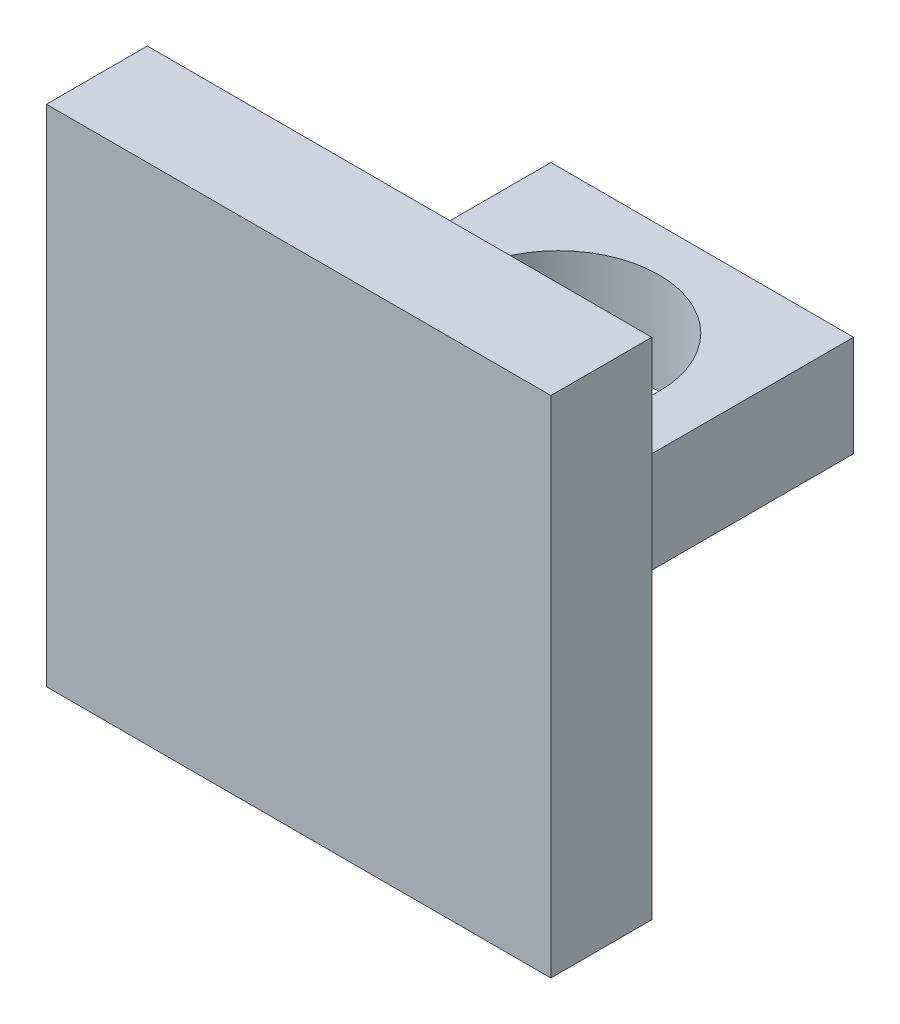
from build123d import *

# Parameters (mm, degrees)
SKETCH_1_W          = 50
SKETCH_1_H          = 50
EXTRUDE_1_DEPTH     = 10
SKETCH_2_W          = 30
SKETCH_2_H          = 10
EXTRUDE_2_DEPTH     = 30
SKETCH_3_R          = 10
CUT_EXTRUDE_1_DEPTH = 30


with BuildPart() as part:
    # 草图1 → 凸台-拉伸1 (new body)
    with BuildSketch(Plane.XY):
        Rectangle(SKETCH_1_W, SKETCH_1_H)
    extrude(amount=EXTRUDE_1_DEPTH)

    # 草图2 → 凸台-拉伸2 (add)
    with BuildSketch(Plane(origin=(0, 0, 0), x_dir=(-1, 0, 0), z_dir=(0, 0, -1))):
        Rectangle(SKETCH_2_W, SKETCH_2_H)
    extrude(amount=EXTRUDE_2_DEPTH)

    # 草图3 → 切除-拉伸1 (cut)
    with BuildSketch(Plane(origin=(0, 5, 0), x_dir=(1, 0, 0), z_dir=(0, 1, 0))):
        with Locations((0, 15.717133963)):
            Circle(SKETCH_3_R)
    extrude(amount=-CUT_EXTRUDE_1_DEPTH, mode=Mode.SUBTRACT)


solid = part.part
